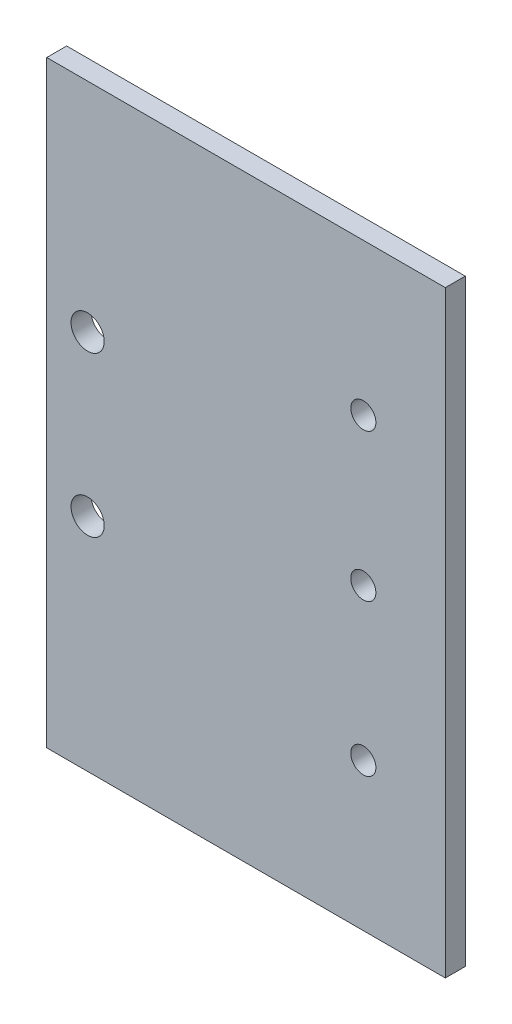
from build123d import *

# Parameters (mm, degrees)
SKETCH2_W           = 100
SKETCH2_H           = 150
BOSS_EXTRUDE1_DEPTH = 5
SKETCH3_R           = 3.15
SKETCH3_R_2         = 4.165
CUT_EXTRUDE1_DEPTH  = 5


with BuildPart() as part:
    # Sketch2 → Boss-Extrude1 (new body)
    with BuildSketch(Plane.XY):
        with Locations((-173.010889244, -74.49468588)):
            Rectangle(SKETCH2_W, SKETCH2_H)
    extrude(amount=BOSS_EXTRUDE1_DEPTH)

    # Sketch3 → Cut-Extrude1 (cut)
    with BuildSketch(Plane(origin=(0, 0, 0), x_dir=(-1, 0, 0), z_dir=(0, 0, -1))):
        with Locations((143.584758496, -37.5)):
            Circle(SKETCH3_R)
        with Locations((143.584758496, -74.49468588)):
            Circle(SKETCH3_R)
        with Locations((143.584758496, -112.5)):
            Circle(SKETCH3_R)
        with Locations((212.756022811, -54.012878845)):
            Circle(SKETCH3_R_2)
        with Locations((212.756022811, -94.012878845)):
            Circle(SKETCH3_R_2)
    extrude(amount=-CUT_EXTRUDE1_DEPTH, mode=Mode.SUBTRACT)


solid = part.part
